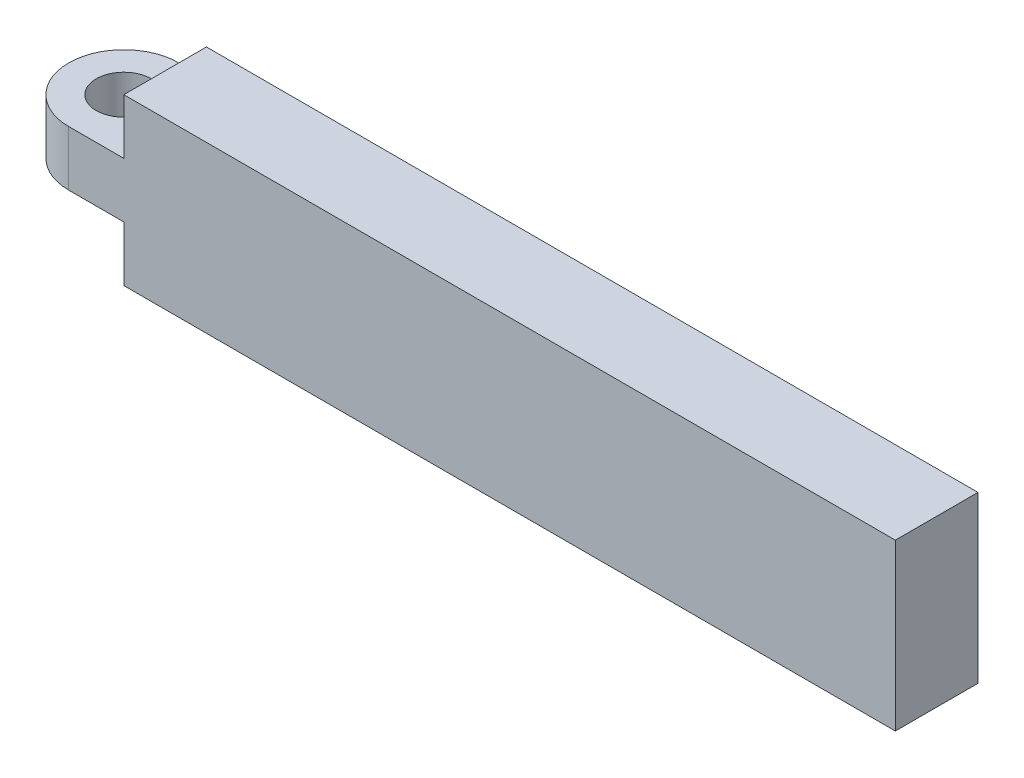
from build123d import *

# Parameters (mm, degrees)
SKETCH1_W           = 14
SKETCH1_H           = 2
BOSS_EXTRUDE1_DEPTH = 3
CHAMFER1_SIZE       = 0.5
SKETCH2_W           = 2
SKETCH2_H           = 1
BOSS_EXTRUDE2_DEPTH = 2
SKETCH3_R           = 0.5
CUT_EXTRUDE1_DEPTH  = 2


with BuildPart() as part:
    # Sketch1 → Boss-Extrude1 (new body)
    with BuildSketch(Plane(origin=(0, 0, 0), x_dir=(1, 0, 0), z_dir=(0, 1, 0))):
        Rectangle(SKETCH1_W, SKETCH1_H)
    extrude(amount=BOSS_EXTRUDE1_DEPTH)

    # Chamfer1
    chamfer1_edges = [part.edges().sort_by_distance(p)[0] for p in [
        (0, 0, -1),
        (7, 1.5, -1),
        (0, 3, -1),
    ]]
    chamfer(chamfer1_edges, length=CHAMFER1_SIZE)

    # Sketch2 → Boss-Extrude2 (add)
    with BuildSketch(Plane.ZY.offset(7)):
        with Locations((0, 1.5)):
            Rectangle(SKETCH2_W, SKETCH2_H)
    extrude(amount=BOSS_EXTRUDE2_DEPTH)

    # Sketch3 → Cut-Extrude1 (cut)
    with BuildSketch(Plane(origin=(0, 2, 0), x_dir=(1, 0, 0), z_dir=(0, 1, 0))):
        with BuildLine():
            Line((-9, -1), (-8, -1))
            ThreePointArc((-8, -1), (-8.707106781, -0.707106781), (-9, 0))
            Line((-9, 0), (-9, -1))
        make_face()
        with BuildLine():
            ThreePointArc((-9, 0), (-8.707106781, 0.707106781), (-8, 1))
            Line((-8, 1), (-9, 1))
            Line((-9, 1), (-9, 0))
        make_face()
        with Locations((-8, 0)):
            Circle(SKETCH3_R)
    extrude(amount=-CUT_EXTRUDE1_DEPTH, mode=Mode.SUBTRACT)


solid = part.part
